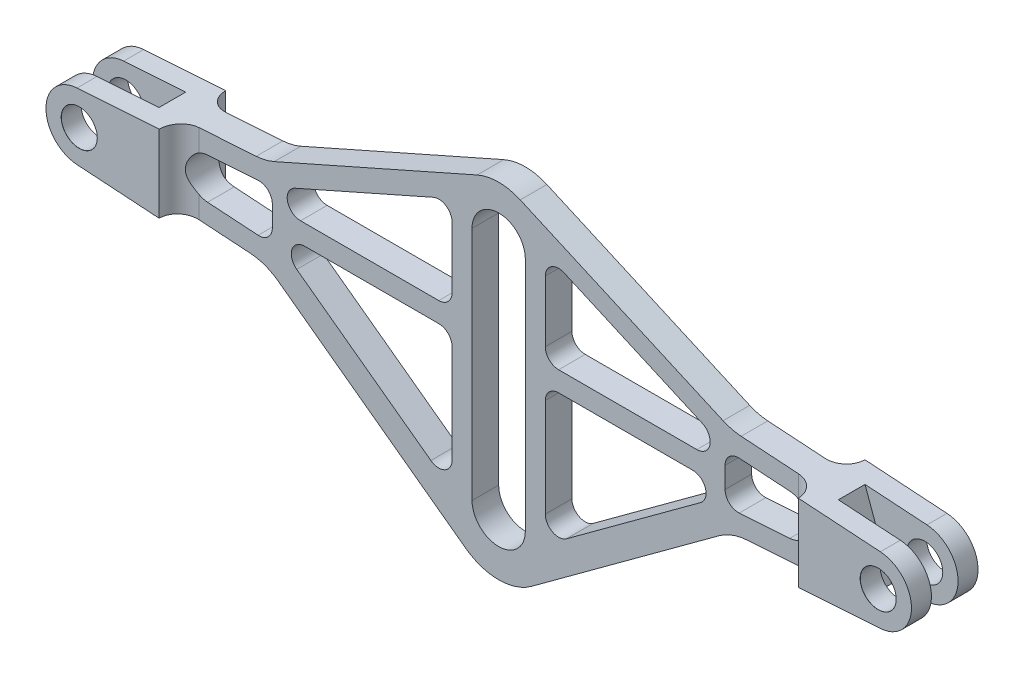
from build123d import *

# Parameters (mm, degrees)
BOSS_EXTRUDE1_DEPTH                    = 12.5
SKETCH2_W                              = 240
SKETCH2_H                              = 181.658858688
CUT_EXTRUDE1_DEPTH                     = 7.5
F_13_5_13_5_DIAMETER_HOLE1_D           = 13.5
F_13_5_13_5_DIAMETER_HOLE1_CSINK_D     = 13.55
F_13_5_13_5_DIAMETER_HOLE1_CSINK_ANGLE = 90
CUT_EXTRUDE2_DEPTH                     = 5
FILLET1_R                              = 7.5
FILLET2_R                              = 20
CUT_EXTRUDE3_DEPTH                     = 181.166481325
CUT_EXTRUDE4_DEPTH                     = 181.166481325
CUT_EXTRUDE5_DEPTH                     = 181.166481325


with BuildPart() as part:
    # Sketch1 → Boss-Extrude1 (new, symmetric)
    with BuildSketch(Plane.XY):
        with BuildLine():
            Line((-150.817539115, 12.47323654), (-87.5, 16.623287311))
            Line((-87.5, 16.623287311), (-8.098559617, 51.78697165))
            ThreePointArc((-8.098559617, 51.78697165), (0, 53.5), (8.098559617, 51.78697165))
            Line((8.098559617, 51.78697165), (87.5, 16.623287311))
            Line((87.5, 16.623287311), (150.817539115, 12.47323654))
            ThreePointArc((150.817539115, 12.47323654), (162.5, 0), (150.817539115, -12.47323654))
            Line((150.817539115, -12.47323654), (87.5, -16.623287311))
            Line((87.5, -16.623287311), (12.310141778, -71.78094771))
            ThreePointArc((12.310141778, -71.78094771), (0, -75.812010875), (-12.310141778, -71.78094771))
            Line((-12.310141778, -71.78094771), (-87.5, -16.623287311))
            Line((-87.5, -16.623287311), (-150.817539115, -12.47323654))
            ThreePointArc((-150.817539115, -12.47323654), (-162.5, 0), (-150.817539115, 12.47323654))
        make_face()
    extrude(amount=BOSS_EXTRUDE1_DEPTH, both=True)

    # Sketch2 → Cut-Extrude1 (cut)
    with BuildSketch(Plane.XY.offset(12.5)):
        Rectangle(SKETCH2_W, SKETCH2_H)
    cut_extrude1 = extrude(amount=-CUT_EXTRUDE1_DEPTH, mode=Mode.SUBTRACT)

    # Mirror2: Cut-Extrude1 across plane
    add(cut_extrude1.mirror(Plane.XY), mode=Mode.SUBTRACT)

    # Ø13.5 (13.5) Diameter Hole1 (through all)
    with Locations(Plane.XY.offset(12.5)):
        with Locations((-150, 0), (150, 0)):
            CounterSinkHole(F_13_5_13_5_DIAMETER_HOLE1_D / 2, F_13_5_13_5_DIAMETER_HOLE1_CSINK_D / 2, counter_sink_angle=F_13_5_13_5_DIAMETER_HOLE1_CSINK_ANGLE)

    # Sketch5 → Cut-Extrude2 (cut, symmetric)
    with BuildSketch(Plane.XY):
        with BuildLine():
            Line((-137.5, -13.34611417), (-127.54739536, 13.998442342))
            Line((-127.54739536, 13.998442342), (-150.817539115, 12.47323654))
            ThreePointArc((-150.817539115, 12.47323654), (-162.5, 0), (-150.817539115, -12.47323654))
            Line((-150.817539115, -12.47323654), (-137.5, -13.34611417))
        make_face()
    cut_extrude2 = extrude(amount=CUT_EXTRUDE2_DEPTH, both=True, mode=Mode.SUBTRACT)

    # Mirror3: Cut-Extrude2 across plane
    add(cut_extrude2.mirror(Plane(origin=(0, 0, 0), x_dir=(0, 0, 1), z_dir=(1, 0, 0))), mode=Mode.SUBTRACT)

    # Fillet1
    fillet1_edges = [part.edges().sort_by_distance(p)[0] for p in [
        (120, 0, -5),
        (120, 0, 5),
        (-120, 0, -5),
        (-120, 0, 5),
    ]]
    fillet(fillet1_edges, radius=FILLET1_R - 0.0001)  # a hair under: the kernel refuses the full size

    # Fillet2
    fillet2_edges = [part.edges().sort_by_distance(p)[0] for p in [
        (-87.5, 16.623287311, 0),
        (87.5, 16.623287311, 0),
        (87.5, -16.623287311, 0),
        (-87.5, -16.623287311, 0),
    ]]
    fillet(fillet2_edges, radius=FILLET2_R)

    # Sketch6 → Cut-Extrude3 (cut, through all)
    with BuildSketch(Plane.XY.offset(5)):
        with BuildLine():
            Line((10, 33.5), (10, -55))
            ThreePointArc((10, -55), (0, -65), (-10, -55))
            Line((-10, -55), (-10, 33.5))
            ThreePointArc((-10, 33.5), (0, 43.5), (10, 33.5))
        make_face()
    extrude(amount=-CUT_EXTRUDE3_DEPTH, mode=Mode.SUBTRACT)

    # Sketch7 → Cut-Extrude4 (cut, through all)
    with BuildSketch(Plane.XY.offset(5)):
        with BuildLine():
            Line((76.433247958, 13.321742913), (24.524639904, 36.309964527))
            ThreePointArc((24.524639904, 36.309964527), (19.772656927, 35.928877859), (17.5, 31.738221615))
            Line((17.5, 31.738221615), (17.5, 8.75))
            ThreePointArc((17.5, 8.75), (18.964466094, 5.214466094), (22.5, 3.75))
            Line((22.5, 3.75), (74.408608053, 3.75))
            ThreePointArc((74.408608053, 3.75), (79.300372283, 7.715281334), (76.433247958, 13.321742913))
        make_face()
        with BuildLine():
            Line((75.830583045, -12.781553657), (25.457460923, -49.734191007))
            ThreePointArc((25.457460923, -49.734191007), (20.240277076, -50.162867423), (17.5, -45.70263735))
            Line((17.5, -45.70263735), (17.5, -8.75))
            ThreePointArc((17.5, -8.75), (18.964466094, -5.214466094), (22.5, -3.75))
            Line((22.5, -3.75), (72.873122122, -3.75))
            ThreePointArc((72.873122122, -3.75), (77.624846456, -7.194006473), (75.830583045, -12.781553657))
        make_face()
    cut_extrude4 = extrude(amount=-CUT_EXTRUDE4_DEPTH, mode=Mode.SUBTRACT)

    # Mirror4: Cut-Extrude4 across plane
    add(cut_extrude4.mirror(Plane(origin=(0, 0, 0), x_dir=(0, 0, 1), z_dir=(1, 0, 0))), mode=Mode.SUBTRACT)

    # Sketch8 → Cut-Extrude5 (cut, symmetric)
    with BuildSketch(Plane.XY.offset(5)):
        with BuildLine():
            Line((-109.308995171, 7.677757716), (-90.327015646, 8.921902385))
            ThreePointArc((-90.327015646, 8.921902385), (-86.58203849, 7.581928132), (-85, 3.932607769))
            Line((-85, 3.932607769), (-85, -3.932607769))
            ThreePointArc((-85, -3.932607769), (-86.58203849, -7.581928132), (-90.327015646, -8.921902385))
            Line((-90.327015646, -8.921902385), (-109.308995171, -7.677757716))
            ThreePointArc((-109.308995171, -7.677757716), (-116.5, 0), (-109.308995171, 7.677757716))
        make_face()
    cut_extrude5 = extrude(amount=CUT_EXTRUDE5_DEPTH, both=True, mode=Mode.SUBTRACT)

    # Mirror5: Cut-Extrude5 across plane
    add(cut_extrude5.mirror(Plane(origin=(0, 0, 0), x_dir=(0, 0, 1), z_dir=(1, 0, 0))), mode=Mode.SUBTRACT)


solid = part.part
